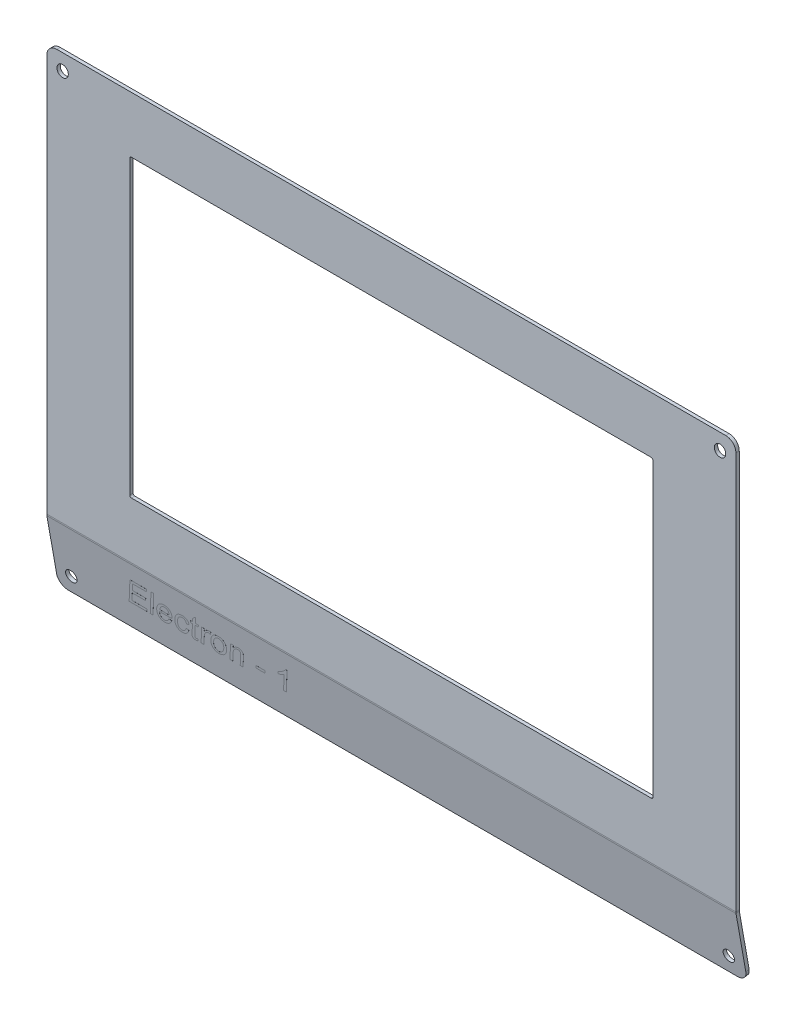
from build123d import *

# Parameters (mm, degrees)
SKETCH_2_W                      = 205.5
SKETCH_2_H                      = 121.5
SM_BASE_FLANGE_1_DEPTH          = 1
SM_EDGE_FLANGE_1_DEPTH          = 205.5
FILLET_1_R                      = 3
SKETCH_12_W                     = 156
SKETCH_12_H                     = 88
CUT_EXTRUDE_2_DEPTH             = 10
FILLET_2_R                      = 0.5
HOLE_WIZARD_M31_D               = 3.4
HOLE_WIZARD_M31_DEPTH           = 8.5
HOLE_WIZARD_M31_TIP             = 1.021463052
HOLE_WIZARD_M31_ON_FACE_2_D     = 3.4
HOLE_WIZARD_M31_ON_FACE_2_DEPTH = 8.5
HOLE_WIZARD_M31_ON_FACE_2_TIP   = 1.021463052
HOLE_WIZARD_M31_ON_FACE_3_D     = 3.4
HOLE_WIZARD_M31_ON_FACE_3_DEPTH = 8.5
HOLE_WIZARD_M31_ON_FACE_3_TIP   = 1.021463052
EXTRUDE_1_DEPTH                 = 0.01


# Sheet-metal steps are written as plain solids
with BuildPart() as part:
    # Sketch 2 → Базовая кромка1 (new body)
    with BuildSketch(Plane.XY):
        Rectangle(SKETCH_2_W, SKETCH_2_H)
    extrude(amount=-SM_BASE_FLANGE_1_DEPTH)

    # Ребро-кромка1 section (across the edge) → Ребро-кромка1 (add)
    with BuildSketch(Plane(origin=(102.75, -60.889981862, -1), x_dir=(0, 0.1736481776669237, -0.9848077530122092), z_dir=(-1, 0, 0))):
        with BuildLine():
            Line((-1, 0.139981862), (-1, 19.912511336))
            Line((-1, 19.912511336), (0, 19.912511336))
            Line((0, 19.912511336), (0, 0.139981862))
            ThreePointArc((0, 0.139981862), (0.006088483, 0.000532673), (0.024307595, -0.137855223))
            Line((0.024307595, -0.137855223), (-0.960500158, -0.3115034))
            ThreePointArc((-0.960500158, -0.3115034), (-0.990106215, -0.08662307), (-1, 0.139981862))
        make_face()
    extrude(amount=SM_EDGE_FLANGE_1_DEPTH)

    # Скругление1
    fillet_1_edges = [part.edges().sort_by_distance(p)[0] for p in [
        (102.75, -80.586801497, -3.96536743),
        (-102.75, -80.586801497, -3.96536743),
        (-102.75, 60.75, -0.5),
        (102.75, 60.75, -0.5),
    ]]
    fillet(fillet_1_edges, radius=FILLET_1_R)

    # Эскиз12 → Вырез-Вытянуть2 (cut)
    with BuildSketch(Plane.XY):
        Rectangle(SKETCH_12_W, SKETCH_12_H)
    extrude(amount=-CUT_EXTRUDE_2_DEPTH, mode=Mode.SUBTRACT)

    # Скругление2
    fillet_2_edges = [part.edges().sort_by_distance(p)[0] for p in [
        (-78, -44, -0.5),
        (-78, 44, -0.5),
        (78, 44, -0.5),
        (78, -44, -0.5),
    ]]
    fillet(fillet_2_edges, radius=FILLET_2_R)

    # Сверло под метчик  спиральное M31
    with Locations(Plane(origin=(-98.021320344, -75.77058326, -2.608424904), x_dir=(0, 0.984807753012, 0.173648177667), z_dir=(0, -0.173648177667, 0.984807753012))):
        with Locations((0, 0)):
            Hole(HOLE_WIZARD_M31_D / 2, depth=HOLE_WIZARD_M31_DEPTH)
            with Locations((0, 0, -(HOLE_WIZARD_M31_DEPTH + HOLE_WIZARD_M31_TIP / 2))):  # 118° drill point
                Cone(0, HOLE_WIZARD_M31_D / 2, HOLE_WIZARD_M31_TIP, mode=Mode.SUBTRACT)

    # Сверло под метчик  спиральное M31 on face 2
    with Locations(Plane(origin=(98.021320344, -75.77058326, -2.608424904), x_dir=(0, 0.984807790843, 0.17364796312), z_dir=(0, -0.17364796312, 0.984807790843))):
        with Locations((0, 0)):
            Hole(HOLE_WIZARD_M31_ON_FACE_2_D / 2, depth=HOLE_WIZARD_M31_ON_FACE_2_DEPTH)
            with Locations((0, 0, -(HOLE_WIZARD_M31_ON_FACE_2_DEPTH + HOLE_WIZARD_M31_ON_FACE_2_TIP / 2))):  # 118° drill point
                Cone(0, HOLE_WIZARD_M31_ON_FACE_2_D / 2, HOLE_WIZARD_M31_ON_FACE_2_TIP, mode=Mode.SUBTRACT)

    # Сверло под метчик  спиральное M31 on face 3
    with Locations(Plane(origin=(-98.021320344, 55.994949149, 0), x_dir=(1, 0, 0), z_dir=(0, 0, 1))):
        with Locations((0, 0), (196.042640688, 0)):
            Hole(HOLE_WIZARD_M31_ON_FACE_3_D / 2, depth=HOLE_WIZARD_M31_ON_FACE_3_DEPTH)
            with Locations((0, 0, -(HOLE_WIZARD_M31_ON_FACE_3_DEPTH + HOLE_WIZARD_M31_ON_FACE_3_TIP / 2))):  # 118° drill point
                Cone(0, HOLE_WIZARD_M31_ON_FACE_3_D / 2, HOLE_WIZARD_M31_ON_FACE_3_TIP, mode=Mode.SUBTRACT)

    # Эскиз16 → Бобышка-Вытянуть1 (add)
    # profile 1 of 10: a face of its own
    with BuildSketch(Plane(origin=(0, -1.838695719, 10.427761604), x_dir=(1, 0, 0), z_dir=(0, -0.17364817766692364, 0.9848077530122092))):
        Polygon((-80.31274708, -72.397424412), (-78.876849644, -65.397424412), (-73.940952208, -65.397424412), (-74.068556375, -66.20511672), (-78.220599644, -66.20511672), (-78.663708619, -68.358962874), (-74.658900926, -68.358962874), (-74.838388106, -69.166655181), (-78.827771119, -69.166655181), (-79.325567593, -71.589732104), (-74.904293555, -71.589732104), (-75.068356055, -72.397424412), align=None)
    # profile 2 of 10: a face of its own
    with BuildSketch(Plane(origin=(0, -1.838695719, 10.427761604), x_dir=(1, 0, 0), z_dir=(0, -0.17364817766692364, 0.9848077530122092))):
        Polygon((-74.025086824, -72.397424412), (-72.594798362, -65.397424412), (-71.773083619, -65.397424412), (-73.20337208, -72.397424412), align=None)
    # profile 3 of 10: a face of its own
    with BuildSketch(Plane(origin=(0, -1.838695719, 10.427761604), x_dir=(1, 0, 0), z_dir=(0, -0.17364817766692364, 0.9848077530122092))):
        with BuildLine():
            Line((-68.17212208, -70.692296207), (-67.339189388, -70.782039797))
            add(Edge.make_bspline(
                [(-67.339189388, -70.782039797), (-67.355476956, -70.83289661), (-67.388365873, -70.935589995), (-67.457187468, -71.084934059), (-67.540570968, -71.231765207), (-67.636049357, -71.378647294), (-67.74703901, -71.52313746), (-67.874200301, -71.664492349), (-68.014306978, -71.804816913), (-68.167453989, -71.94107238), (-68.33025005, -72.070167276), (-68.505429158, -72.181192535), (-68.687763181, -72.274893893), (-68.877439299, -72.35334609), (-69.075302417, -72.413027727), (-69.281088212, -72.457034045), (-69.49473353, -72.482366627), (-69.639738194, -72.485553664), (-69.713187785, -72.487168002)],
                knots=[0, 0, 0, 0, 0.821440156, 1.658705401, 2.525323128, 3.419405186, 4.353419828, 5.32681938, 6.344399772, 7.404443113, 8.481060479, 9.538977106, 10.591299887, 11.633537695, 12.694215778, 13.768160887, 14.869500701, 16, 16, 16, 16], degree=3))
            add(Edge.make_bspline(
                [(-69.713187785, -72.487168002), (-69.804525986, -72.483742072), (-69.985183112, -72.476965952), (-70.250452188, -72.428794026), (-70.503795681, -72.346371083), (-70.743159654, -72.233166214), (-70.964868065, -72.090343428), (-71.156790233, -71.911184941), (-71.324845951, -71.706895933), (-71.459899334, -71.472018961), (-71.566489133, -71.214987526), (-71.641188371, -70.938230641), (-71.689159007, -70.644881469), (-71.694587356, -70.443357294), (-71.697362465, -70.340333066)],
                knots=[0, 0, 0, 0, 0.998551589, 1.975027533, 2.936744805, 3.903838964, 4.863557655, 5.807675034, 6.763178998, 7.745855275, 8.758641806, 9.797744155, 10.874151411, 12, 12, 12, 12], degree=3))
            add(Edge.make_bspline(
                [(-71.697362465, -70.340333066), (-71.69640544, -70.271579293), (-71.694488011, -70.133828955), (-71.675161508, -69.928368485), (-71.646356582, -69.724076654), (-71.603531402, -69.52204077), (-71.550671253, -69.320942325), (-71.484397374, -69.12218954), (-71.406877807, -68.924581197), (-71.317895397, -68.730347297), (-71.219937946, -68.542590451), (-71.112201306, -68.366978526), (-71.000750295, -68.201788489), (-70.880227115, -68.050387367), (-70.751632932, -67.912276387), (-70.61723712, -67.786183358), (-70.476474757, -67.671177845), (-70.327334436, -67.570858479), (-70.174011135, -67.481676171), (-70.017448525, -67.40346537), (-69.856838666, -67.339050094), (-69.693207358, -67.286190025), (-69.52715479, -67.243214868), (-69.357799981, -67.214393388), (-69.185458647, -67.195089137), (-69.069143638, -67.193230618), (-69.010663747, -67.192296207)],
                knots=[0, 0, 0, 0, 1.075906032, 2.155611451, 3.227554832, 4.30373447, 5.38628686, 6.480642286, 7.581143633, 8.707391042, 9.82337293, 10.893692135, 11.930684225, 12.940768785, 13.919223559, 14.881988069, 15.823529777, 16.761054785, 17.692163021, 18.598508727, 19.497917784, 20.397951545, 21.288749041, 22.180057169, 23.084984307, 24, 24, 24, 24], degree=3))
            add(Edge.make_bspline(
                [(-69.010663747, -67.192296207), (-68.93719172, -67.193704291), (-68.79394197, -67.196449658), (-68.584555496, -67.223932133), (-68.386791798, -67.268246416), (-68.200095043, -67.330836574), (-68.023510825, -67.408294667), (-67.860375892, -67.508044478), (-67.708005316, -67.623479028), (-67.567800067, -67.755414433), (-67.44101399, -67.902508483), (-67.332365402, -68.064898603), (-67.236570564, -68.238041437), (-67.161628477, -68.42587193), (-67.102533214, -68.625863809), (-67.060836793, -68.838984714), (-67.035287793, -69.064600718), (-67.0322482, -69.219403946), (-67.030695798, -69.298466079)],
                knots=[0, 0, 0, 0, 1.079196217, 2.10412856, 3.097265039, 4.052997914, 4.993829394, 5.924450447, 6.855882321, 7.798592485, 8.748507102, 9.702980304, 10.665060364, 11.651045023, 12.668191174, 13.725659051, 14.838433479, 16, 16, 16, 16], degree=3))
            add(Edge.make_bspline(
                [(-67.030695798, -69.298466079), (-67.033808717, -69.424413601), (-67.040149409, -69.680955613), (-67.077558096, -69.934846277), (-67.096601247, -70.064091079)],
                knots=[0, 0, 0, 0, 0.981886135, 2, 2, 2, 2], degree=3))
            Line((-67.096601247, -70.064091079), (-70.799926567, -70.064091079))
            add(Edge.make_bspline(
                [(-70.799926567, -70.064091079), (-70.813521854, -70.089083818), (-70.83915326, -70.136203021), (-70.868265109, -70.207852559), (-70.885850053, -70.275910069), (-70.888444454, -70.320614891), (-70.889670157, -70.34173531)],
                knots=[0, 0, 0, 0, 1.156942796, 2.181202349, 3.140724307, 4, 4, 4, 4], degree=3))
            add(Edge.make_bspline(
                [(-70.889670157, -70.34173531), (-70.888560815, -70.401599733), (-70.886407614, -70.517794855), (-70.870756945, -70.686435549), (-70.845962964, -70.844511725), (-70.810348984, -70.991726773), (-70.761495785, -71.127149366), (-70.705920636, -71.253189771), (-70.639159051, -71.368732883), (-70.559566001, -71.470682883), (-70.474622379, -71.562379115), (-70.382775833, -71.640354022), (-70.288620834, -71.709233881), (-70.188246067, -71.764365726), (-70.08283393, -71.805795437), (-69.973663568, -71.837585322), (-69.859657658, -71.856087203), (-69.7819634, -71.857996431), (-69.742634901, -71.858962874)],
                knots=[0, 0, 0, 0, 1.346284225, 2.613098929, 3.805631801, 4.942804233, 6.013450698, 7.039235158, 8.038108926, 9.00533571, 9.942442562, 10.84439418, 11.710848438, 12.56244313, 13.41163356, 14.253504373, 15.115931414, 16, 16, 16, 16], degree=3))
            add(Edge.make_bspline(
                [(-69.742634901, -71.858962874), (-69.666980064, -71.855712626), (-69.514416486, -71.849158261), (-69.289117179, -71.78655537), (-69.064488313, -71.694165133), (-68.885166325, -71.58404143), (-68.743912412, -71.482121259), (-68.645127736, -71.392631164), (-68.549774055, -71.297241792), (-68.462468696, -71.191660737), (-68.378799079, -71.07964169), (-68.303536924, -70.958064393), (-68.232605652, -70.829367511), (-68.192480155, -70.738432832), (-68.17212208, -70.692296207)],
                knots=[0, 0, 0, 0, 1.313044299, 2.647851039, 4.03980324, 5.527339259, 6.29475363, 7.066375866, 7.842396062, 8.63863277, 9.446691243, 10.272184996, 11.123375662, 12, 12, 12, 12], degree=3))
        make_face()
        with BuildLine():
            Line((-70.662506696, -69.435885951), (-67.842594837, -69.435885951))
            add(Edge.make_bspline(
                [(-67.842594837, -69.435885951), (-67.841587835, -69.395689762), (-67.839901776, -69.328387817), (-67.838822701, -69.261073581), (-67.838388106, -69.233962874)],
                knots=[0, 0, 0, 0, 1.194503009, 2, 2, 2, 2], degree=3))
            add(Edge.make_bspline(
                [(-67.838388106, -69.233962874), (-67.839699118, -69.178789241), (-67.842258714, -69.071069274), (-67.855303662, -68.914339117), (-67.881082183, -68.767741167), (-67.915218666, -68.630732431), (-67.962456798, -68.504631014), (-68.01595959, -68.38692565), (-68.083353171, -68.281025928), (-68.158446076, -68.184673103), (-68.241546261, -68.098520143), (-68.330988289, -68.024278296), (-68.426709249, -67.961775504), (-68.527267516, -67.909228426), (-68.635189158, -67.870694336), (-68.747502346, -67.840351347), (-68.866201657, -67.82369694), (-68.947047887, -67.82157975), (-68.988227849, -67.820501335)],
                knots=[0, 0, 0, 0, 1.288915635, 2.516454775, 3.668675548, 4.762204166, 5.808675246, 6.809806692, 7.776046417, 8.732555008, 9.659000055, 10.566141369, 11.441184925, 12.324901883, 13.209090714, 14.112018255, 15.038334656, 16, 16, 16, 16], degree=3))
            add(Edge.make_bspline(
                [(-68.988227849, -67.820501335), (-69.033659792, -67.82126279), (-69.123566391, -67.822769656), (-69.256564199, -67.84452224), (-69.387252389, -67.873761923), (-69.513814141, -67.920171887), (-69.637929298, -67.976182204), (-69.759267658, -68.044717028), (-69.875276383, -68.129226561), (-69.9906128, -68.222093616), (-70.100607722, -68.329067319), (-70.202037194, -68.45022184), (-70.29890465, -68.58228229), (-70.384203173, -68.729272023), (-70.467254326, -68.886336157), (-70.53848902, -69.058493631), (-70.607155202, -69.241680162), (-70.643772195, -69.370154238), (-70.662506696, -69.435885951)],
                knots=[0, 0, 0, 0, 0.867869597, 1.717452491, 2.571772394, 3.425671253, 4.289803496, 5.174634535, 6.084973587, 7.031591473, 8.005136717, 9.013559597, 10.050697067, 11.133079613, 12.260592687, 13.446148552, 14.693362615, 16, 16, 16, 16], degree=3))
        make_face(mode=Mode.SUBTRACT)
    # profile 4 of 10: a face of its own
    with BuildSketch(Plane(origin=(0, -1.838695719, 10.427761604), x_dir=(1, 0, 0), z_dir=(0, -0.17364817766692364, 0.9848077530122092))):
        with BuildLine():
            Line((-62.99223426, -70.512809027), (-62.184541952, -70.602552617))
            add(Edge.make_bspline(
                [(-62.184541952, -70.602552617), (-62.212145402, -70.68002705), (-62.266101493, -70.831465279), (-62.360532512, -71.047711029), (-62.462702689, -71.248816558), (-62.573399445, -71.434620722), (-62.693318883, -71.604886329), (-62.820079223, -71.7616257), (-62.958353061, -71.900300211), (-63.103422353, -72.024339569), (-63.254676311, -72.134024548), (-63.412650912, -72.228164606), (-63.575157589, -72.308451838), (-63.743685661, -72.373505659), (-63.916956805, -72.423481731), (-64.095510592, -72.460290602), (-64.278876102, -72.48354579), (-64.403289812, -72.485954202), (-64.465992272, -72.487168002)],
                knots=[0, 0, 0, 0, 1.240566549, 2.424918714, 3.557168939, 4.642022354, 5.684825849, 6.697040216, 7.679409172, 8.634778597, 9.574269363, 10.494641324, 11.406108526, 12.305823581, 13.216390057, 14.123673624, 15.054362412, 16, 16, 16, 16], degree=3))
            add(Edge.make_bspline(
                [(-64.465992272, -72.487168002), (-64.532908355, -72.485588796), (-64.664426981, -72.482484984), (-64.856574767, -72.457035087), (-65.038529414, -72.414540582), (-65.211640193, -72.357516418), (-65.374021866, -72.280791753), (-65.528678193, -72.190298053), (-65.670218349, -72.078750769), (-65.803969821, -71.95476947), (-65.924204542, -71.814840447), (-66.029211419, -71.660832722), (-66.115756689, -71.492053467), (-66.189141578, -71.311215799), (-66.245084249, -71.116591425), (-66.283714652, -70.909022739), (-66.307930791, -70.688660766), (-66.311114822, -70.537179148), (-66.31274708, -70.459523771)],
                knots=[0, 0, 0, 0, 1.03650477, 2.037173682, 2.996310351, 3.928381449, 4.855006824, 5.774073815, 6.69823389, 7.64096301, 8.596127175, 9.55022005, 10.521959611, 11.529210567, 12.569730121, 13.653431089, 14.797057381, 16, 16, 16, 16], degree=3))
            add(Edge.make_bspline(
                [(-66.31274708, -70.459523771), (-66.308588675, -70.321412754), (-66.300273055, -70.045230299), (-66.236248753, -69.63360055), (-66.132031378, -69.22599047), (-66.010640171, -68.893631207), (-65.896782291, -68.634841101), (-65.80001135, -68.451902574), (-65.692609702, -68.282354033), (-65.579114911, -68.122662836), (-65.456241373, -67.975004), (-65.321766282, -67.841690314), (-65.179945044, -67.719148936), (-65.029933475, -67.608557196), (-64.872927834, -67.509553695), (-64.708136496, -67.426601324), (-64.539870343, -67.352362933), (-64.365265796, -67.293503556), (-64.185056, -67.248809171), (-63.999487478, -67.216688957), (-63.808315754, -67.196506034), (-63.678915913, -67.193710828), (-63.61342817, -67.192296207)],
                knots=[0, 0, 0, 0, 1.747186092, 3.493871485, 5.258462769, 7.064095634, 7.964365261, 8.834919225, 9.680105451, 10.502485135, 11.312843302, 12.107528363, 12.896025571, 13.682745882, 14.463976912, 15.241729354, 16.015309456, 16.789703234, 17.570127716, 18.362674598, 19.171368805, 20, 20, 20, 20], degree=3))
            add(Edge.make_bspline(
                [(-63.61342817, -67.192296207), (-63.546519127, -67.193454441), (-63.415576579, -67.195721132), (-63.224716331, -67.218907441), (-63.044514259, -67.254982033), (-62.875067223, -67.305088955), (-62.716717135, -67.371570113), (-62.569136619, -67.452976104), (-62.432209322, -67.549273144), (-62.305885655, -67.658363121), (-62.192980444, -67.779979125), (-62.093688308, -67.911182982), (-62.010423251, -68.052338322), (-61.943200508, -68.20361776), (-61.889663673, -68.363659205), (-61.851976404, -68.533268727), (-61.829040973, -68.712159991), (-61.826743181, -68.83472045), (-61.825567593, -68.897424412)],
                knots=[0, 0, 0, 0, 1.151139111, 2.2528059, 3.303596003, 4.311504149, 5.288666288, 6.253698404, 7.206717763, 8.164850814, 9.121158269, 10.057598539, 10.991685941, 11.935149611, 12.901890432, 13.89142637, 14.921218772, 16, 16, 16, 16], degree=3))
            Line((-61.825567593, -68.897424412), (-62.633259901, -68.987168002))
            add(Edge.make_bspline(
                [(-62.633259901, -68.987168002), (-62.634362862, -68.942712655), (-62.636517577, -68.855865874), (-62.652494681, -68.729802572), (-62.676078168, -68.611111048), (-62.708497076, -68.499955136), (-62.748433674, -68.395529456), (-62.799860991, -68.299735191), (-62.858734654, -68.21035185), (-62.927547748, -68.129490713), (-63.002990141, -68.057042825), (-63.083557561, -67.992563543), (-63.17095432, -67.939437173), (-63.264025359, -67.895706113), (-63.362783485, -67.86182337), (-63.467702402, -67.838561907), (-63.577852873, -67.822076988), (-63.653562599, -67.82103149), (-63.691953811, -67.820501335)],
                knots=[0, 0, 0, 0, 1.200963251, 2.34616976, 3.428643536, 4.46788345, 5.47175217, 6.443564348, 7.399904643, 8.358910235, 9.305778675, 10.223036756, 11.141511475, 12.062501262, 12.997160286, 13.956165878, 14.96360385, 16, 16, 16, 16], degree=3))
            add(Edge.make_bspline(
                [(-63.691953811, -67.820501335), (-63.736863414, -67.821685935), (-63.825544485, -67.824025114), (-63.956562303, -67.839397141), (-64.082587548, -67.866364742), (-64.205135139, -67.902474243), (-64.321629076, -67.952347067), (-64.435151662, -68.009224549), (-64.542423831, -68.079394066), (-64.645719789, -68.158893463), (-64.745116202, -68.249092032), (-64.836807365, -68.351979492), (-64.924533126, -68.464528284), (-65.005480587, -68.588920607), (-65.082804827, -68.72279147), (-65.152873379, -68.868996583), (-65.218470623, -69.025282004), (-65.297849711, -69.246237366), (-65.379103802, -69.52769503), (-65.45081724, -69.864571182), (-65.4969921, -70.195089048), (-65.502393489, -70.413574118), (-65.505054772, -70.521222489)],
                knots=[0, 0, 0, 0, 0.745984424, 1.473063519, 2.187218894, 2.884764228, 3.591282265, 4.289216361, 4.991283846, 5.716495174, 6.452882974, 7.216950381, 8.002758744, 8.821034713, 9.680029069, 10.568957186, 11.511979638, 12.494355148, 14.467326568, 16.372277152, 18.212608056, 20, 20, 20, 20], degree=3))
            add(Edge.make_bspline(
                [(-65.505054772, -70.521222489), (-65.504410015, -70.575474853), (-65.503162601, -70.680437147), (-65.489002364, -70.832297625), (-65.465494876, -70.973496599), (-65.431728211, -71.10427202), (-65.38959367, -71.225289107), (-65.3400161, -71.33728446), (-65.277682108, -71.436982402), (-65.207018301, -71.525812576), (-65.130248168, -71.604178999), (-65.048114199, -71.671732919), (-64.962491461, -71.730628795), (-64.870492432, -71.775476252), (-64.776358944, -71.81559794), (-64.67628384, -71.839237531), (-64.572642924, -71.855744794), (-64.502053798, -71.857874752), (-64.465992272, -71.858962874)],
                knots=[0, 0, 0, 0, 1.364738108, 2.640364945, 3.833343737, 4.962955815, 6.03418035, 7.05522656, 8.037608797, 8.983551246, 9.90670012, 10.792144041, 11.6565613, 12.513908857, 13.363476918, 14.224928758, 15.093177955, 16, 16, 16, 16], degree=3))
            add(Edge.make_bspline(
                [(-64.465992272, -71.858962874), (-64.393122072, -71.854755415), (-64.246204226, -71.846272512), (-64.029694857, -71.781108218), (-63.819442885, -71.674813798), (-63.653058754, -71.554044208), (-63.52406514, -71.438931204), (-63.43147268, -71.338683904), (-63.344213146, -71.227559867), (-63.263658463, -71.104825727), (-63.185456017, -70.973317615), (-63.116306169, -70.828981826), (-63.049875228, -70.675384072), (-63.011709947, -70.567739761), (-62.99223426, -70.512809027)],
                knots=[0, 0, 0, 0, 1.228796005, 2.47744704, 3.783138733, 5.191186112, 5.934310042, 6.699234474, 7.491666228, 8.316741542, 9.176120216, 10.072487705, 11.016393301, 12, 12, 12, 12], degree=3))
        make_face()
    # profile 5 of 10: a face of its own
    with BuildSketch(Plane(origin=(0, -1.838695719, 10.427761604), x_dir=(1, 0, 0), z_dir=(0, -0.17364817766692364, 0.9848077530122092))):
        with BuildLine():
            Line((-59.708179772, -71.715934027), (-59.849806375, -72.417055822))
            add(Edge.make_bspline(
                [(-59.849806375, -72.417055822), (-59.950442444, -72.437146121), (-60.147240799, -72.476433603), (-60.347773089, -72.48364451), (-60.445759901, -72.487168002)],
                knots=[0, 0, 0, 0, 1.02273283, 2, 2, 2, 2], degree=3))
            add(Edge.make_bspline(
                [(-60.445759901, -72.487168002), (-60.520384069, -72.484074978), (-60.662888097, -72.478168467), (-60.865032423, -72.429608115), (-61.044674254, -72.349461237), (-61.143235551, -72.268841285), (-61.19175349, -72.229155181)],
                knots=[0, 0, 0, 0, 1.107510109, 2.114926753, 3.072050883, 4, 4, 4, 4], degree=3))
            add(Edge.make_bspline(
                [(-61.19175349, -72.229155181), (-61.225296825, -72.195014189), (-61.291969713, -72.127153359), (-61.361546904, -71.999232859), (-61.403110358, -71.85407019), (-61.407970066, -71.751286992), (-61.41050349, -71.697704861)],
                knots=[0, 0, 0, 0, 0.966131761, 1.920345611, 2.915850876, 4, 4, 4, 4], degree=3))
            add(Edge.make_bspline(
                [(-61.41050349, -71.697704861), (-61.41036136, -71.681321974), (-61.41003544, -71.643754397), (-61.400817775, -71.580923016), (-61.394320701, -71.503408166), (-61.378427034, -71.412615799), (-61.36304978, -71.307055081), (-61.33889204, -71.188876212), (-61.316415949, -71.055617525), (-61.297240544, -70.962869449), (-61.287106055, -70.913850694)],
                knots=[0, 0, 0, 0, 0.494523005, 1.13399009, 1.91538923, 2.844215137, 3.916947873, 5.138525562, 6.487667681, 8, 8, 8, 8], degree=3))
            Line((-61.287106055, -70.913850694), (-60.658900926, -67.910244925))
            Line((-60.658900926, -67.910244925), (-61.287106055, -67.910244925))
            Line((-61.287106055, -67.910244925), (-61.107618875, -67.282039797))
            Line((-61.107618875, -67.282039797), (-60.479413747, -67.282039797))
            Line((-60.479413747, -67.282039797), (-60.234021119, -66.007400374))
            Line((-60.234021119, -66.007400374), (-59.31274708, -65.397424412))
            Line((-59.31274708, -65.397424412), (-59.671721439, -67.282039797))
            Line((-59.671721439, -67.282039797), (-58.774285542, -67.282039797))
            Line((-58.774285542, -67.282039797), (-58.953772721, -67.910244925))
            Line((-58.953772721, -67.910244925), (-59.851208619, -67.910244925))
            Line((-59.851208619, -67.910244925), (-60.479413747, -70.854956463))
            add(Edge.make_bspline(
                [(-60.479413747, -70.854956463), (-60.487521381, -70.899332956), (-60.502865994, -70.983320474), (-60.522132955, -71.102657179), (-60.539064921, -71.207808083), (-60.553183553, -71.298943585), (-60.56427446, -71.376085216), (-60.573323045, -71.439065003), (-60.577693544, -71.488240864), (-60.578597162, -71.516343493), (-60.578973042, -71.528033386)],
                knots=[0, 0, 0, 0, 1.590268265, 3.009762037, 4.261324545, 5.344990255, 6.260812588, 7.008880922, 7.587722682, 8, 8, 8, 8], degree=3))
            add(Edge.make_bspline(
                [(-60.578973042, -71.528033386), (-60.577925476, -71.553362998), (-60.57594406, -71.60127264), (-60.560511928, -71.668333153), (-60.535031049, -71.726492884), (-60.49775246, -71.775822043), (-60.446723306, -71.814980605), (-60.38143462, -71.841237852), (-60.302458988, -71.856055378), (-60.24530987, -71.857942084), (-60.214389708, -71.858962874)],
                knots=[0, 0, 0, 0, 1.071323269, 2.026352173, 2.894195021, 3.741034877, 4.615617481, 5.582054984, 6.691786485, 8, 8, 8, 8], degree=3))
            add(Edge.make_bspline(
                [(-60.214389708, -71.858962874), (-60.167922226, -71.857750057), (-60.07688726, -71.855374014), (-59.945867854, -71.824830372), (-59.820667692, -71.783063646), (-59.74583383, -71.738404908), (-59.708179772, -71.715934027)],
                knots=[0, 0, 0, 0, 1.043462779, 2.044259608, 3.015932623, 4, 4, 4, 4], degree=3))
        make_face()
    # profile 6 of 10: a face of its own
    with BuildSketch(Plane(origin=(0, -1.838695719, 10.427761604), x_dir=(1, 0, 0), z_dir=(0, -0.17364817766692364, 0.9848077530122092))):
        with BuildLine():
            Line((-58.864029131, -72.397424412), (-57.787106055, -67.282039797))
            Line((-57.787106055, -67.282039797), (-56.965391311, -67.282039797))
            Line((-56.965391311, -67.282039797), (-57.210783939, -68.161246527))
            add(Edge.make_bspline(
                [(-57.210783939, -68.161246527), (-57.14251255, -68.083290443), (-57.012168222, -67.934456011), (-56.811272688, -67.734308792), (-56.616460655, -67.566051166), (-56.426047599, -67.429248752), (-56.237105319, -67.322657022), (-56.046734189, -67.247325049), (-55.853647248, -67.202058586), (-55.724164996, -67.195534254), (-55.659902529, -67.192296207)],
                knots=[0, 0, 0, 0, 1.317415746, 2.515221578, 3.602797499, 4.587383949, 5.492011979, 6.354026978, 7.183098174, 8, 8, 8, 8], degree=3))
            add(Edge.make_bspline(
                [(-55.659902529, -67.192296207), (-55.614518766, -67.19349151), (-55.518801434, -67.196012483), (-55.368535189, -67.214210536), (-55.203805243, -67.242287443), (-55.090004744, -67.26835992), (-55.030295157, -67.282039797)],
                knots=[0, 0, 0, 0, 0.854454067, 1.802099686, 2.846791343, 4, 4, 4, 4], degree=3))
            Line((-55.030295157, -67.282039797), (-55.380856055, -68.089732104))
            add(Edge.make_bspline(
                [(-55.380856055, -68.089732104), (-55.417215715, -68.048839325), (-55.485993886, -67.971486278), (-55.607448901, -67.885847744), (-55.73480872, -67.830087926), (-55.823430549, -67.823682077), (-55.86743458, -67.820501335)],
                knots=[0, 0, 0, 0, 1.139610882, 2.155695371, 3.084234231, 4, 4, 4, 4], degree=3))
            add(Edge.make_bspline(
                [(-55.86743458, -67.820501335), (-55.905450396, -67.822061992), (-55.982863016, -67.82524), (-56.098351999, -67.853776768), (-56.215145893, -67.897910677), (-56.33273766, -67.960497663), (-56.452153974, -68.03971401), (-56.573323638, -68.135711089), (-56.695017777, -68.250255784), (-56.819488275, -68.38189469), (-56.940922462, -68.537326552), (-57.05619911, -68.720077617), (-57.164371097, -68.930878343), (-57.268004541, -69.168888609), (-57.36616176, -69.434240675), (-57.455553816, -69.727971297), (-57.544080967, -70.048205294), (-57.593279155, -70.27275936), (-57.618836824, -70.389411592)],
                knots=[0, 0, 0, 0, 0.549463368, 1.118886924, 1.711931635, 2.353427189, 3.042026111, 3.783708105, 4.587857209, 5.458936652, 6.403515595, 7.437581918, 8.58132111, 9.829397418, 11.192852412, 12.673529843, 14.271952167, 16, 16, 16, 16], degree=3))
            Line((-57.618836824, -70.389411592), (-58.040912144, -72.397424412))
            Line((-58.040912144, -72.397424412), (-58.864029131, -72.397424412))
        make_face()
    # profile 7 of 10: a face of its own
    with BuildSketch(Plane(origin=(0, -1.838695719, 10.427761604), x_dir=(1, 0, 0), z_dir=(0, -0.17364817766692364, 0.9848077530122092))):
        with BuildLine():
            add(Edge.make_bspline(
                [(-55.543516311, -70.449708066), (-55.540842419, -70.328529265), (-55.535602919, -70.091078965), (-55.49391255, -69.743045299), (-55.426949825, -69.41085774), (-55.333541106, -69.093969826), (-55.210541599, -68.793723036), (-55.061437099, -68.509630464), (-54.886159169, -68.240214466), (-54.747902622, -68.076673333), (-54.678332016, -67.99437954)],
                knots=[0, 0, 0, 0, 1.091636214, 2.139065119, 3.15337043, 4.142118544, 5.111151322, 6.071929978, 7.029796406, 8, 8, 8, 8], degree=3))
            add(Edge.make_bspline(
                [(-54.678332016, -67.99437954), (-54.618043624, -67.930258977), (-54.49898551, -67.803633053), (-54.29722785, -67.641063518), (-54.084003913, -67.500390292), (-53.854377041, -67.3885157), (-53.612359596, -67.298714087), (-53.355525779, -67.238628852), (-53.085686912, -67.198896937), (-52.900903581, -67.194530714), (-52.806336824, -67.192296207)],
                knots=[0, 0, 0, 0, 1.003816656, 1.982347091, 2.950416354, 3.914638646, 4.892193557, 5.891460313, 6.920910456, 8, 8, 8, 8], degree=3))
            add(Edge.make_bspline(
                [(-52.806336824, -67.192296207), (-52.732396926, -67.193714253), (-52.587750998, -67.196488325), (-52.376074861, -67.224035161), (-52.175244627, -67.267927499), (-51.985916548, -67.332257276), (-51.80694806, -67.411277115), (-51.640110472, -67.511067055), (-51.483627411, -67.627595942), (-51.340212518, -67.762410428), (-51.208684697, -67.91040154), (-51.096970055, -68.07428645), (-51.000775863, -68.249278341), (-50.921498334, -68.437005905), (-50.862098907, -68.638086119), (-50.818760863, -68.851063323), (-50.791255366, -69.076192923), (-50.788511268, -69.230609479), (-50.787106055, -69.309684027)],
                knots=[0, 0, 0, 0, 1.074521535, 2.102047325, 3.097891715, 4.058516371, 5.004534796, 5.936932244, 6.87884093, 7.835708239, 8.794022425, 9.751637559, 10.712718837, 11.693422109, 12.708216539, 13.755795132, 14.850774227, 16, 16, 16, 16], degree=3))
            add(Edge.make_bspline(
                [(-50.787106055, -69.309684027), (-50.788143853, -69.381701957), (-50.790208813, -69.524999653), (-50.808007556, -69.737878835), (-50.834083016, -69.947191893), (-50.871771951, -70.152912962), (-50.922806445, -70.354351602), (-50.983168839, -70.552293491), (-51.052749641, -70.746727509), (-51.135718271, -70.935023912), (-51.227463316, -71.116452232), (-51.328219437, -71.288511046), (-51.439959266, -71.448384627), (-51.55824302, -71.599246095), (-51.688587834, -71.737227163), (-51.827712804, -71.864595616), (-51.974526785, -71.983512763), (-52.131967568, -72.087517648), (-52.293605288, -72.181033848), (-52.458282125, -72.262995347), (-52.62515457, -72.331767683), (-52.794459511, -72.387738498), (-52.965514811, -72.433828381), (-53.139792194, -72.463228136), (-53.315282308, -72.484752937), (-53.433072776, -72.48636238), (-53.492033939, -72.487168002)],
                knots=[0, 0, 0, 0, 1.113712978, 2.216010697, 3.301923386, 4.375322326, 5.448404726, 6.514107199, 7.57523888, 8.640352675, 9.694367893, 10.718505129, 11.721213829, 12.709140676, 13.680905449, 14.653046635, 15.625160939, 16.599638006, 17.568089429, 18.512164449, 19.442549022, 20.357011946, 21.268841998, 22.179295356, 23.088628615, 24, 24, 24, 24], degree=3))
            add(Edge.make_bspline(
                [(-53.492033939, -72.487168002), (-53.587598548, -72.484438408), (-53.775755321, -72.479064123), (-54.050677166, -72.429577774), (-54.312788843, -72.351148385), (-54.559151227, -72.240776725), (-54.78482255, -72.101003402), (-54.985517128, -71.934647212), (-55.155436585, -71.739214604), (-55.297082261, -71.520192889), (-55.408817176, -71.278516729), (-55.485920335, -71.017657933), (-55.535850213, -70.739538177), (-55.540914083, -70.548089789), (-55.543516311, -70.449708066)],
                knots=[0, 0, 0, 0, 1.056399493, 2.079940691, 3.079426922, 4.07698514, 5.057020575, 6.007752417, 6.949498362, 7.910468461, 8.884496851, 9.883983082, 10.912618727, 12, 12, 12, 12], degree=3))
        make_face()
        with BuildLine():
            add(Edge.make_bspline(
                [(-54.735824003, -70.375389156), (-54.734866065, -70.434334115), (-54.733006838, -70.54873827), (-54.715246418, -70.714961708), (-54.689871621, -70.870440676), (-54.651572777, -71.014968399), (-54.602865347, -71.148577103), (-54.542504329, -71.271510938), (-54.470510647, -71.382644732), (-54.389062128, -71.483267958), (-54.297537427, -71.570212151), (-54.202226566, -71.649110153), (-54.098589114, -71.713651912), (-53.989635991, -71.766966471), (-53.874334115, -71.808121798), (-53.753515948, -71.837087549), (-53.626792549, -71.856281639), (-53.540249264, -71.858059038), (-53.49624067, -71.858962874)],
                knots=[0, 0, 0, 0, 1.295111093, 2.513634637, 3.670576723, 4.754563163, 5.794674135, 6.791678566, 7.757713875, 8.699574419, 9.629537537, 10.528041662, 11.414483195, 12.305852245, 13.189730166, 14.099209151, 15.033418569, 16, 16, 16, 16], degree=3))
            add(Edge.make_bspline(
                [(-53.49624067, -71.858962874), (-53.449431423, -71.857565775), (-53.355348309, -71.85475771), (-53.214203484, -71.833267005), (-53.074300165, -71.795935003), (-52.934706218, -71.747513804), (-52.798399143, -71.682603901), (-52.666743501, -71.602298685), (-52.539468056, -71.508038576), (-52.420040902, -71.397912711), (-52.304972918, -71.278150066), (-52.199563183, -71.14801538), (-52.10122351, -71.010867228), (-51.983992482, -70.815310392), (-51.855547575, -70.553840479), (-51.782028268, -70.331972392), (-51.744838426, -70.219740117)],
                knots=[0, 0, 0, 0, 0.76417638, 1.535937823, 2.324535878, 3.125956315, 3.945310896, 4.784335597, 5.640677184, 6.526804992, 7.433724549, 8.350386764, 9.258910639, 10.186940784, 12.071158785, 14, 14, 14, 14], degree=3))
            add(Edge.make_bspline(
                [(-51.744838426, -70.219740117), (-51.721556946, -70.140605642), (-51.675805532, -69.985095167), (-51.630795848, -69.750337566), (-51.60087254, -69.520792511), (-51.596806083, -69.369136216), (-51.594798362, -69.294259348)],
                knots=[0, 0, 0, 0, 1.051458283, 2.066264747, 3.045261931, 4, 4, 4, 4], degree=3))
            add(Edge.make_bspline(
                [(-51.594798362, -69.294259348), (-51.595780805, -69.23764924), (-51.59770153, -69.126973549), (-51.615348572, -68.96636826), (-51.640541987, -68.814837981), (-51.681245683, -68.674216669), (-51.728538706, -68.541531201), (-51.792108317, -68.420551603), (-51.862466318, -68.307392102), (-51.946413775, -68.206618298), (-52.036753979, -68.115730785), (-52.133883126, -68.036421076), (-52.237015223, -67.970851287), (-52.344637723, -67.914233261), (-52.459733589, -67.873498759), (-52.579648928, -67.841884772), (-52.70526075, -67.823314524), (-52.790851683, -67.821449734), (-52.834381696, -67.820501335)],
                knots=[0, 0, 0, 0, 1.253550686, 2.450756499, 3.575994275, 4.651243888, 5.689823827, 6.690069589, 7.672416166, 8.636253265, 9.588057668, 10.508190281, 11.407164882, 12.291652033, 13.195740229, 14.104854296, 15.036162901, 16, 16, 16, 16], degree=3))
            add(Edge.make_bspline(
                [(-52.834381696, -67.820501335), (-52.901850879, -67.822983142), (-53.034987465, -67.82788048), (-53.229943686, -67.865085282), (-53.415856515, -67.927263894), (-53.591539368, -68.015281857), (-53.758836805, -68.12573595), (-53.916135185, -68.260721943), (-54.066404605, -68.417022926), (-54.207766364, -68.59432465), (-54.333949796, -68.791673113), (-54.446898248, -69.004544206), (-54.536228451, -69.235425297), (-54.609735114, -69.476044311), (-54.663191893, -69.717118036), (-54.705490583, -69.948442782), (-54.729993689, -70.166391163), (-54.733931846, -70.307561426), (-54.735824003, -70.375389156)],
                knots=[0, 0, 0, 0, 0.919050019, 1.813556585, 2.693819998, 3.582615606, 4.483630389, 5.419133169, 6.401208198, 7.434815353, 8.503776263, 9.589310032, 10.713026768, 11.871659109, 13.015133757, 14.075998022, 15.075579492, 16, 16, 16, 16], degree=3))
        make_face(mode=Mode.SUBTRACT)
    # profile 8 of 10: a face of its own
    with BuildSketch(Plane(origin=(0, -1.838695719, 10.427761604), x_dir=(1, 0, 0), z_dir=(0, -0.17364817766692364, 0.9848077530122092))):
        with BuildLine():
            Line((-50.248644516, -72.397424412), (-49.199766311, -67.282039797))
            Line((-49.199766311, -67.282039797), (-48.376649324, -67.282039797))
            Line((-48.376649324, -67.282039797), (-48.556136503, -68.152833066))
            add(Edge.make_bspline(
                [(-48.556136503, -68.152833066), (-48.478677259, -68.072744961), (-48.330519553, -67.919558986), (-48.102053598, -67.717810367), (-47.88269364, -67.549902899), (-47.669008575, -67.416712467), (-47.45637615, -67.317005185), (-47.243758704, -67.244154597), (-47.027596849, -67.200599226), (-46.88251339, -67.195054413), (-46.810343234, -67.192296207)],
                knots=[0, 0, 0, 0, 1.303073863, 2.492413087, 3.562021232, 4.531777384, 5.431989548, 6.303527241, 7.156108467, 8, 8, 8, 8], degree=3))
            add(Edge.make_bspline(
                [(-46.810343234, -67.192296207), (-46.763556198, -67.193345802), (-46.672004082, -67.195399633), (-46.538574672, -67.212218057), (-46.413117024, -67.240959989), (-46.294561969, -67.277162321), (-46.185835112, -67.329883178), (-46.082295928, -67.388951715), (-45.988720761, -67.462911786), (-45.902488332, -67.545870075), (-45.826001721, -67.638446946), (-45.757545884, -67.738255416), (-45.702316344, -67.846768292), (-45.655259567, -67.961492073), (-45.618538771, -68.083975261), (-45.594303606, -68.214240824), (-45.578192884, -68.35155318), (-45.576061364, -68.445386295), (-45.574966631, -68.493578258)],
                knots=[0, 0, 0, 0, 1.106801267, 2.165770826, 3.174582853, 4.150362596, 5.09039195, 6.027358781, 6.965304099, 7.90383602, 8.853959592, 9.80176327, 10.761365257, 11.728647482, 12.732841939, 13.78043189, 14.860046965, 16, 16, 16, 16], degree=3))
            add(Edge.make_bspline(
                [(-45.574966631, -68.493578258), (-45.575054522, -68.518370028), (-45.575242239, -68.571320224), (-45.583872958, -68.655828518), (-45.592773525, -68.75039771), (-45.607508072, -68.85505934), (-45.62546702, -68.969640991), (-45.648612278, -69.094242684), (-45.672916062, -69.229237633), (-45.693363841, -69.321902119), (-45.703973042, -69.369980502)],
                knots=[0, 0, 0, 0, 0.670266849, 1.43155415, 2.29590979, 3.240092325, 4.289873351, 5.433255951, 6.668261098, 8, 8, 8, 8], degree=3))
            Line((-45.703973042, -69.369980502), (-46.375647721, -72.397424412))
            Line((-46.375647721, -72.397424412), (-47.197362465, -72.397424412))
            Line((-47.197362465, -72.397424412), (-46.506056375, -69.110565438))
            add(Edge.make_bspline(
                [(-46.506056375, -69.110565438), (-46.490662418, -69.035863813), (-46.462162473, -68.897563298), (-46.428954591, -68.705073694), (-46.409670424, -68.543502855), (-46.4055361, -68.445937229), (-46.403692593, -68.402432425)],
                knots=[0, 0, 0, 0, 1.277367925, 2.36488355, 3.270896701, 4, 4, 4, 4], degree=3))
            add(Edge.make_bspline(
                [(-46.403692593, -68.402432425), (-46.405985204, -68.361133012), (-46.410430503, -68.281054795), (-46.440844892, -68.166507892), (-46.496465804, -68.065810255), (-46.570993385, -67.977903624), (-46.666751874, -67.90671776), (-46.782134504, -67.856058097), (-46.915760752, -67.824949256), (-47.011148964, -67.822034932), (-47.061344837, -67.820501335)],
                knots=[0, 0, 0, 0, 0.998953181, 1.936937683, 2.837381912, 3.759494591, 4.704605448, 5.696368127, 6.787766214, 8, 8, 8, 8], degree=3))
            add(Edge.make_bspline(
                [(-47.061344837, -67.820501335), (-47.114253102, -67.822188354), (-47.219203115, -67.825534761), (-47.374272852, -67.850220666), (-47.525078183, -67.889547059), (-47.671981421, -67.944405316), (-47.813756685, -68.016271655), (-47.950579406, -68.104662937), (-48.084390971, -68.206673259), (-48.212246812, -68.327166363), (-48.336025857, -68.464570218), (-48.447486026, -68.62690151), (-48.553345116, -68.809833417), (-48.648826302, -69.016389876), (-48.737665092, -69.244828494), (-48.816379994, -69.49572356), (-48.888660713, -69.768869394), (-48.927326107, -69.959630134), (-48.947362465, -70.058482104)],
                knots=[0, 0, 0, 0, 0.794260461, 1.575512707, 2.351830678, 3.131441636, 3.92560905, 4.733644196, 5.574573765, 6.448597128, 7.368403126, 8.345931202, 9.399360886, 10.539159743, 11.759188529, 13.077745749, 14.485691588, 16, 16, 16, 16], degree=3))
            Line((-48.947362465, -70.058482104), (-49.426929772, -72.397424412))
            Line((-49.426929772, -72.397424412), (-50.248644516, -72.397424412))
        make_face()
    # profile 9 of 10: a face of its own
    with BuildSketch(Plane(origin=(0, -1.838695719, 10.427761604), x_dir=(1, 0, 0), z_dir=(0, -0.17364817766692364, 0.9848077530122092))):
        Polygon((-42.171721439, -70.333321848), (-41.99223426, -69.52562954), (-39.299926567, -69.52562954), (-39.479413747, -70.333321848), align=None)
    # profile 10 of 10: a face of its own
    with BuildSketch(Plane(origin=(0, -1.838695719, 10.427761604), x_dir=(1, 0, 0), z_dir=(0, -0.17364817766692364, 0.9848077530122092))):
        with BuildLine():
            Line((-34.274285542, -72.397424412), (-33.197362465, -67.195100694))
            add(Edge.make_bspline(
                [(-33.197362465, -67.195100694), (-33.258887858, -67.241363273), (-33.384911531, -67.336123823), (-33.590727863, -67.46373508), (-33.813056169, -67.586873687), (-34.054679912, -67.700264469), (-34.312933057, -67.811196272), (-34.591058392, -67.910064568), (-34.885400483, -68.00711827), (-35.089624071, -68.061762219), (-35.194157337, -68.089732104)],
                knots=[0, 0, 0, 0, 0.838359274, 1.717227777, 2.63582179, 3.606248445, 4.624055798, 5.697042507, 6.821215173, 8, 8, 8, 8], degree=3))
            Line((-35.194157337, -68.089732104), (-35.034301567, -67.371783386))
            add(Edge.make_bspline(
                [(-35.034301567, -67.371783386), (-34.927595076, -67.323948183), (-34.711718319, -67.227173296), (-34.395709901, -67.057334328), (-34.080157308, -66.869959304), (-33.824996948, -66.695634087), (-33.625690792, -66.552045851), (-33.484713178, -66.447681786), (-33.353677372, -66.346393511), (-33.232923907, -66.248348099), (-33.12241718, -66.153066526), (-33.021434265, -66.061903384), (-32.929442598, -65.975245437), (-32.873664322, -65.916500948), (-32.846801567, -65.888209669)],
                knots=[0, 0, 0, 0, 1.583313545, 3.203184633, 4.855583746, 6.551690609, 7.386215473, 8.182603945, 8.927160296, 9.629134756, 10.288998473, 10.903058912, 11.471714409, 12, 12, 12, 12], degree=3))
            add(Edge.make_bspline(
                [(-32.846801567, -65.888209669), (-32.81591699, -65.853096683), (-32.752605227, -65.781116905), (-32.665182859, -65.662730472), (-32.578947755, -65.534597927), (-32.525237889, -65.443981292), (-32.497642913, -65.397424412)],
                knots=[0, 0, 0, 0, 0.929584414, 1.905599249, 2.923941894, 4, 4, 4, 4], degree=3))
            Line((-32.497642913, -65.397424412), (-32.013868875, -65.397424412))
            Line((-32.013868875, -65.397424412), (-33.452570798, -72.397424412))
            Line((-33.452570798, -72.397424412), (-34.274285542, -72.397424412))
        make_face()
    extrude(amount=EXTRUDE_1_DEPTH)


solid = part.part
